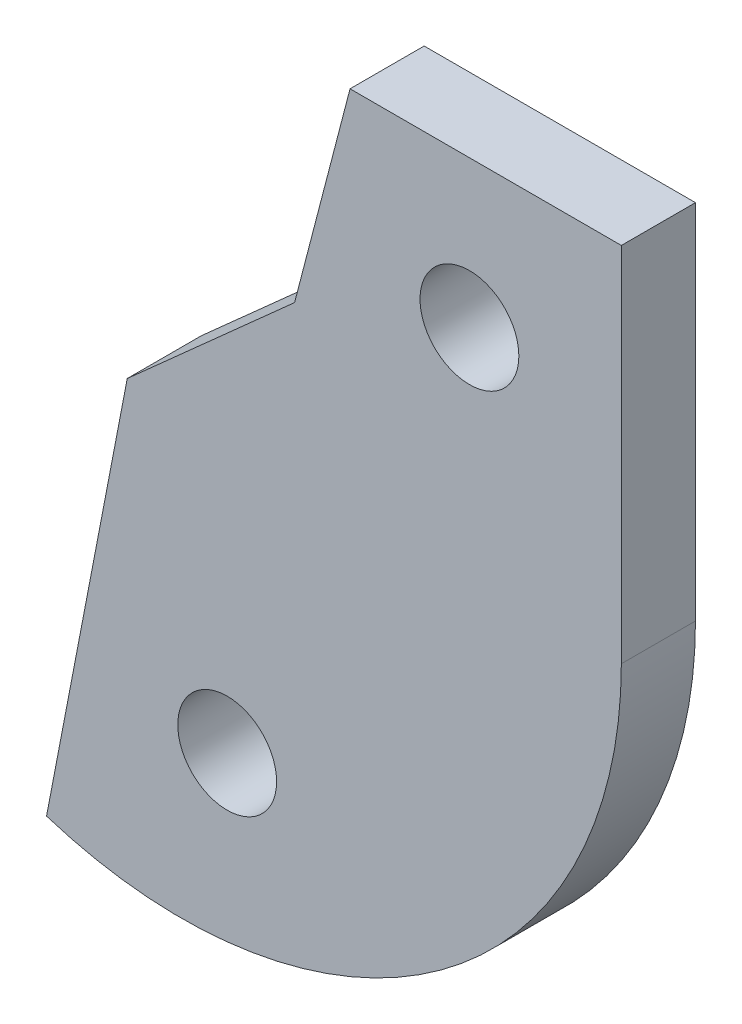
from build123d import *

# Parameters (mm, degrees)
SKETCH2_R           = 2
BOSS_EXTRUDE1_DEPTH = 3


with BuildPart() as part:
    # Sketch2 → Boss-Extrude1 (new body)
    with BuildSketch(Plane(origin=(0, 0, 0), x_dir=(-1, 0, 0), z_dir=(0, 0, 1))):
        with BuildLine():
            Line((-6.774175166, 1.283626341), (0, 7.332311194))
            Line((0, 7.332311194), (3.26719031, 24.305930805))
            ThreePointArc((3.26719031, 24.305930805), (-12.680293068, 21.732536084), (-20, 7.332311194))
            Line((-20, 7.332311194), (-20, -7.332311194))
            Line((-20, -7.332311194), (-9.017950721, -7.332311194))
            Line((-9.017950721, -7.332311194), (-6.774175166, 1.283626341))
        make_face()
        with Locations((-13.851036571, -1.379219301)):
            Circle(SKETCH2_R, mode=Mode.SUBTRACT)
        with Locations((-4.045326452, 18.443425538)):
            Circle(SKETCH2_R, mode=Mode.SUBTRACT)
    extrude(amount=BOSS_EXTRUDE1_DEPTH)


solid = part.part
